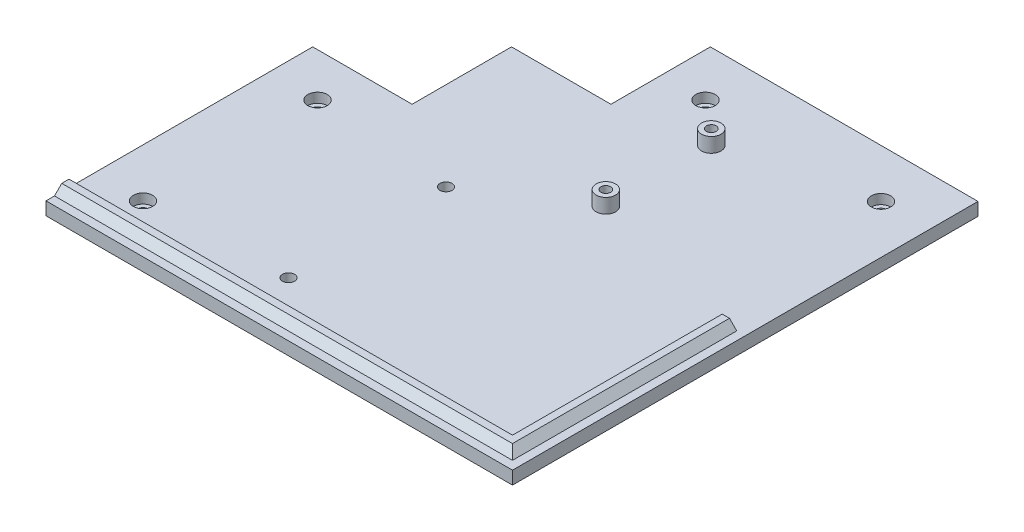
from build123d import *

# Parameters (mm, degrees)
SKETCH1_W                      = 192.4
SKETCH1_H                      = 192
BOSS_EXTRUDE1_DEPTH            = 6.35
CUT_EXTRUDE1_REACH             = 138.054
SKETCH2_W                      = 41
SKETCH2_H                      = 41
CBORE_FOR_M4_SHCS1_D           = 4.5
CBORE_FOR_M4_SHCS1_CBORE_D     = 8
CBORE_FOR_M4_SHCS1_CBORE_DEPTH = 4
SKETCH5_R                      = 2.5
CUT_EXTRUDE2_DEPTH             = 6
CUT_EXTRUDE3_REACH             = 138.038
SKETCH6_R                      = 2.25
CUT_EXTRUDE4_REACH             = 138.054
SKETCH7_R                      = 1.75
BOSS_EXTRUDE2_START            = 6
SKETCH11_R                     = 4
SKETCH11_R_2                   = 1.75
BOSS_EXTRUDE2_DEPTH            = 6
SKETCH8_R                      = 2
CUT_EXTRUDE5_DEPTH             = 5
EXTRUDE_THIN1_DEPTH            = 3
CHAMFER1_SIZE                  = 3
CHAMFER2_SIZE                  = 1


with BuildPart() as part:
    # Sketch1 → Boss-Extrude1 (new body)
    with BuildSketch(Plane(origin=(0, 0, 0), x_dir=(1, 0, 0), z_dir=(0, 1, 0))):
        Rectangle(SKETCH1_W, SKETCH1_H)
    extrude(amount=BOSS_EXTRUDE1_DEPTH)

    # Sketch2 → Cut-Extrude1 (cut, up to next)
    with BuildSketch(Plane(origin=(0, 6.35, 0), x_dir=(1, 0, 0), z_dir=(0, 1, 0)), mode=Mode.PRIVATE) as cut_extrude1_sk1:
        with Locations((-75.7, 34.5)):
            Rectangle(SKETCH2_W, SKETCH2_H)
    cut_extrude1_tool1 = extrude(cut_extrude1_sk1.sketch, amount=-CUT_EXTRUDE1_REACH, mode=Mode.PRIVATE) & part.part
    # Sketch2 → Cut-Extrude1 (cut, up to next)
    with BuildSketch(Plane(origin=(0, 6.35, 0), x_dir=(1, 0, 0), z_dir=(0, 1, 0)), mode=Mode.PRIVATE) as cut_extrude1_sk2:
        with Locations((-75.7, 75.5)):
            Rectangle(SKETCH2_W, SKETCH2_H)
    cut_extrude1_tool2 = extrude(cut_extrude1_sk2.sketch, amount=-CUT_EXTRUDE1_REACH, mode=Mode.PRIVATE) & part.part
    # Sketch2 → Cut-Extrude1 (cut, up to next)
    with BuildSketch(Plane(origin=(0, 6.35, 0), x_dir=(1, 0, 0), z_dir=(0, 1, 0)), mode=Mode.PRIVATE) as cut_extrude1_sk3:
        with Locations((-34.7, 75.5)):
            Rectangle(SKETCH2_W, SKETCH2_H)
    cut_extrude1_tool3 = extrude(cut_extrude1_sk3.sketch, amount=-CUT_EXTRUDE1_REACH, mode=Mode.PRIVATE) & part.part
    add(cut_extrude1_tool1.solids().sort_by_distance((-75.7, 6.35, -34.5))[0], mode=Mode.SUBTRACT)
    add(cut_extrude1_tool2.solids().sort_by_distance((-75.7, 6.35, -75.5))[0], mode=Mode.SUBTRACT)
    add(cut_extrude1_tool3.solids().sort_by_distance((-34.7, 6.35, -75.5))[0], mode=Mode.SUBTRACT)

    # CBORE for M4 SHCS1 (through all)
    with Locations(Plane(origin=(0, 6.35, 0), x_dir=(1, 0, 0), z_dir=(0, 1, 0))):
        with Locations((76.2, 76), (-76.2, -4), (-76.2, -76), (3.8, 76)):
            CounterBoreHole(CBORE_FOR_M4_SHCS1_D / 2, CBORE_FOR_M4_SHCS1_CBORE_D / 2, CBORE_FOR_M4_SHCS1_CBORE_DEPTH)

    # Sketch5 → Cut-Extrude2 (cut)
    with BuildSketch(Plane(origin=(0, 6.35, 0), x_dir=(1, 0, 0), z_dir=(0, 1, 0))):
        with Locations(Location((-18.7, -8.525, 0), (0, 0, 270))):
            Circle(SKETCH5_R)
        with Locations(Location((-18.7, -73.475, 0), (0, 0, 270))):
            Circle(SKETCH5_R)
    extrude(amount=-CUT_EXTRUDE2_DEPTH, mode=Mode.SUBTRACT)

    # Sketch6 → Cut-Extrude3 (cut, up to next)
    with BuildSketch(Plane(origin=(0, 0.35, 0), x_dir=(1, 0, 0), z_dir=(0, 1, 0)), mode=Mode.PRIVATE) as cut_extrude3_sk1:
        with Locations(Location((-18.7, -8.525, 0), (0, 0, 270))):
            Circle(SKETCH6_R)
    cut_extrude3_tool1 = extrude(cut_extrude3_sk1.sketch, amount=-CUT_EXTRUDE3_REACH, mode=Mode.PRIVATE) & part.part
    # Sketch6 → Cut-Extrude3 (cut, up to next)
    with BuildSketch(Plane(origin=(0, 0.35, 0), x_dir=(1, 0, 0), z_dir=(0, 1, 0)), mode=Mode.PRIVATE) as cut_extrude3_sk2:
        with Locations(Location((-18.7, -73.475, 0), (0, 0, 270))):
            Circle(SKETCH6_R)
    cut_extrude3_tool2 = extrude(cut_extrude3_sk2.sketch, amount=-CUT_EXTRUDE3_REACH, mode=Mode.PRIVATE) & part.part
    add(cut_extrude3_tool1.solids().sort_by_distance((-18.7, 0.35, 8.525))[0], mode=Mode.SUBTRACT)
    add(cut_extrude3_tool2.solids().sort_by_distance((-18.7, 0.35, 73.475))[0], mode=Mode.SUBTRACT)

    # Sketch7 → Cut-Extrude4 (cut, up to next)
    with BuildSketch(Plane(origin=(0, 6.35, 0), x_dir=(1, 0, 0), z_dir=(0, 1, 0)), mode=Mode.PRIVATE) as cut_extrude4_sk1:
        with Locations(Location((21.2, 61, 0), (0, 0, 270))):
            Circle(SKETCH7_R)
    cut_extrude4_tool1 = extrude(cut_extrude4_sk1.sketch, amount=-CUT_EXTRUDE4_REACH, mode=Mode.PRIVATE) & part.part
    # Sketch7 → Cut-Extrude4 (cut, up to next)
    with BuildSketch(Plane(origin=(0, 6.35, 0), x_dir=(1, 0, 0), z_dir=(0, 1, 0)), mode=Mode.PRIVATE) as cut_extrude4_sk2:
        with Locations(Location((21.2, 17.5, 0), (0, 0, 270))):
            Circle(SKETCH7_R)
    cut_extrude4_tool2 = extrude(cut_extrude4_sk2.sketch, amount=-CUT_EXTRUDE4_REACH, mode=Mode.PRIVATE) & part.part
    add(cut_extrude4_tool1.solids().sort_by_distance((21.2, 6.35, -61))[0], mode=Mode.SUBTRACT)
    add(cut_extrude4_tool2.solids().sort_by_distance((21.2, 6.35, -17.5))[0], mode=Mode.SUBTRACT)

    # Sketch11 → Boss-Extrude2 (add)
    # profile 1 of 2: a face of its own
    with BuildSketch(Plane(origin=(0, 6.35, 0), x_dir=(1, 0, 0), z_dir=(0, 1, 0)).offset(BOSS_EXTRUDE2_START)):
        with Locations(Location((21.2, 61, 0), (0, 0, 270))):
            Circle(SKETCH11_R)
        with Locations(Location((21.2, 61, 0), (0, 0, 270))):
            Circle(SKETCH11_R_2, mode=Mode.SUBTRACT)
    # profile 2 of 2: a face of its own
    with BuildSketch(Plane(origin=(0, 6.35, 0), x_dir=(1, 0, 0), z_dir=(0, 1, 0)).offset(BOSS_EXTRUDE2_START)):
        with Locations(Location((21.2, 17.5, 0), (0, 0, 270))):
            Circle(SKETCH11_R)
        with Locations(Location((21.2, 17.5, 0), (0, 0, 270))):
            Circle(SKETCH11_R_2, mode=Mode.SUBTRACT)
    extrude(amount=-BOSS_EXTRUDE2_DEPTH)

    # Sketch8 → Cut-Extrude5 (cut)
    with BuildSketch(Plane(origin=(0, 12.35, 0), x_dir=(1, 0, 0), z_dir=(0, 1, 0))):
        with Locations(Location((21.2, 61, 0), (0, 0, 270))):
            Circle(SKETCH8_R)
        with Locations(Location((21.2, 17.5, 0), (0, 0, 270))):
            Circle(SKETCH8_R)
    extrude(amount=-CUT_EXTRUDE5_DEPTH, mode=Mode.SUBTRACT)

    # Sketch9 → Extrude-Thin1 (add)
    with BuildSketch(Plane(origin=(0, 6.35, 0), x_dir=(1, 0, 0), z_dir=(0, 1, 0))):
        Polygon((-96.2, -89.5), (89.7, -89.5), (89.7, 0), (86.7, 0), (86.7, -86.5), (-96.2, -86.5), align=None)
    extrude(amount=EXTRUDE_THIN1_DEPTH)

    # Chamfer1
    chamfer1_edges = [part.edges().sort_by_distance(p)[0] for p in [
        (-4.75, 6.35, 86.5),
        (86.7, 6.35, 43.25),
        (-3.25, 6.35, 89.5),
        (89.7, 6.35, 44.75),
    ]]
    chamfer(chamfer1_edges, length=CHAMFER1_SIZE - 0.0001)  # a hair under: the kernel refuses the full size

    # Chamfer2
    chamfer2_edges = [part.edges().sort_by_distance(p)[0] for p in [
        (0, 0, 96),
        (96.2, 0, 0),
    ]]
    chamfer(chamfer2_edges, length=CHAMFER2_SIZE)


solid = part.part
